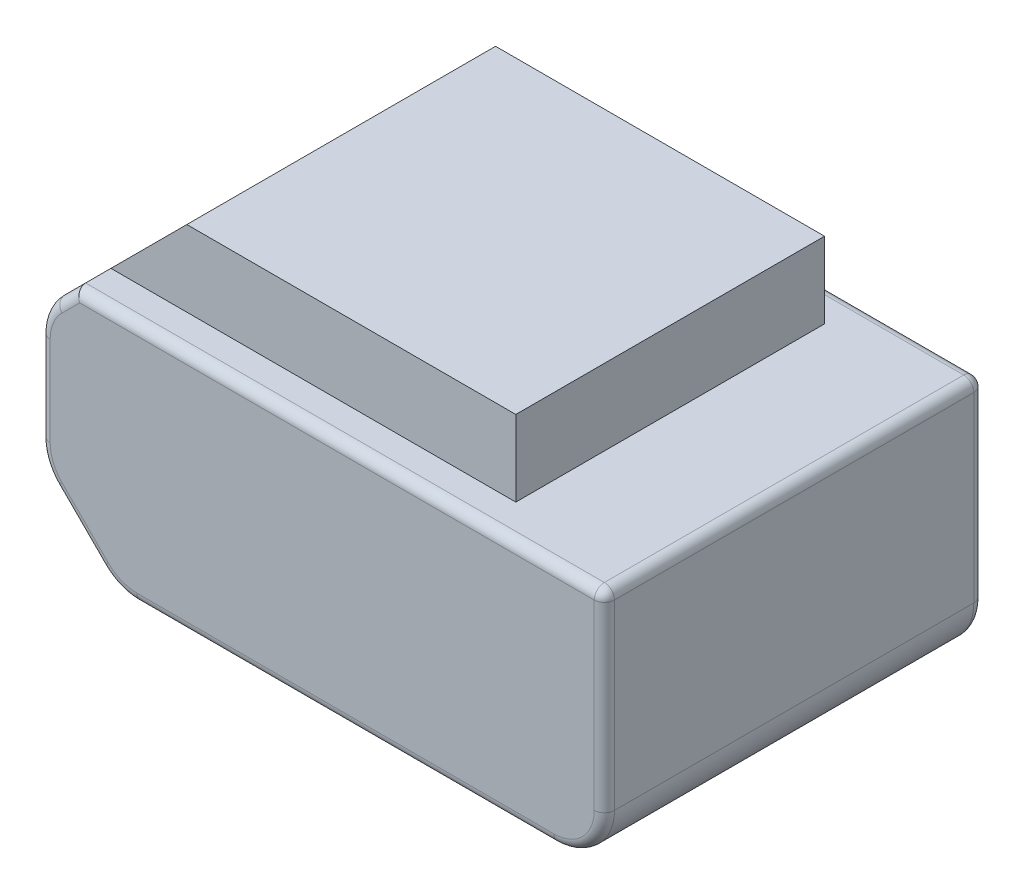
from build123d import *

# Parameters (mm, degrees)
SKETCH1_W           = 111.5
SKETCH1_H           = 75
BOSS_EXTRUDE1_DEPTH = 63
CUT_EXTRUDE1_REACH  = 114.703
SKETCH3_W           = 22
SKETCH3_H           = 7
CUT_EXTRUDE2_DEPTH  = 15
CUT_EXTRUDE3_DEPTH  = 15
FILLET1_R           = 10
FILLET2_R           = 2


with BuildPart() as part:
    # Sketch1 → Boss-Extrude1 (new body)
    with BuildSketch(Plane(origin=(0, 0, 0), x_dir=(1, 0, 0), z_dir=(0, 1, 0))):
        Rectangle(SKETCH1_W, SKETCH1_H)
    extrude(amount=BOSS_EXTRUDE1_DEPTH)

    # Sketch2 → Cut-Extrude1 (cut, up to next)
    with BuildSketch(Plane.XY.offset(37.5), mode=Mode.PRIVATE) as cut_extrude1_sk1:
        Polygon((-55.75, 41), (-33.75, 63), (-55.75, 63), align=None)
    cut_extrude1_tool1 = extrude(cut_extrude1_sk1.sketch, amount=-CUT_EXTRUDE1_REACH, mode=Mode.PRIVATE) & part.part
    # Sketch2 → Cut-Extrude1 (cut, up to next)
    with BuildSketch(Plane.XY.offset(37.5), mode=Mode.PRIVATE) as cut_extrude1_sk2:
        Polygon((-55.75, 15), (-40.75, 0), (-55.75, 0), align=None)
    cut_extrude1_tool2 = extrude(cut_extrude1_sk2.sketch, amount=-CUT_EXTRUDE1_REACH, mode=Mode.PRIVATE) & part.part
    add(cut_extrude1_tool1.solids().sort_by_distance((-48.416667, 55.666667, 37.5))[0], mode=Mode.SUBTRACT)
    add(cut_extrude1_tool2.solids().sort_by_distance((-50.75, 5, 37.5))[0], mode=Mode.SUBTRACT)

    # Sketch3 → Cut-Extrude2 (cut)
    with BuildSketch(Plane(origin=(0, 63, 0), x_dir=(1, 0, 0), z_dir=(0, 1, 0))):
        Polygon((31.25, -30.5), (-33.75, -30.5), (-33.75, -37.5), (55.75, -37.5), (55.75, 37.5), (-33.75, 37.5), (-33.75, 30.5), (31.25, 30.5), align=None)
        with Locations((-44.75, -34)):
            Rectangle(SKETCH3_W, SKETCH3_H)
        with Locations((-44.75, 34)):
            Rectangle(SKETCH3_W, SKETCH3_H)
    extrude(amount=-CUT_EXTRUDE2_DEPTH, mode=Mode.SUBTRACT)

    # Sketch4 → Cut-Extrude3 (cut, symmetric)
    with BuildSketch(Plane.XY):
        Polygon((-53.628679656, 43.121320344), (-38.699747468, 58.050252532), (-38.699747468, 55.221825407), (-50.800252532, 43.121320344), align=None)
    extrude(amount=CUT_EXTRUDE3_DEPTH, both=True, mode=Mode.SUBTRACT)

    # Fillet1
    # the kernel refuses this fillet: 10 mm, written as the material it takes off along each edge
    with BuildSketch(Plane(origin=(-55.75, 41, 47.855339059), x_dir=(0.7071067811865432, 0.7071067811865519, 0), z_dir=(0, 0, -1)), Plane(origin=(-40.75, 0, 47.855339059), x_dir=(-0.707106781186546, 0.707106781186549, 0), z_dir=(0, 0, -1))) as fillet1_piece_1:
        with BuildLine():
            CenterArc((FILLET1_R * 0.414213562373, FILLET1_R), FILLET1_R, 225, 45)
            Line((-FILLET1_R * 0.292893218813, FILLET1_R * 0.292893218813), (0, 0))
            Line((0, 0), (FILLET1_R * 0.414213562373, 0))
        make_face()
    extrude(amount=95.710678119, mode=Mode.SUBTRACT)
    with BuildSketch(Plane(origin=(-55.75, 15, 47.855339059), x_dir=(0.7071067811865466, -0.7071067811865482, 0), z_dir=(0, 0, -1))) as fillet1_piece_2:
        with BuildLine():
            CenterArc((FILLET1_R * 0.414213562373, -FILLET1_R), FILLET1_R, 90, 45)
            Line((-FILLET1_R * 0.292893218813, -FILLET1_R * 0.292893218813), (0, 0))
            Line((0, 0), (FILLET1_R * 0.414213562373, 0))
        make_face()
    extrude(amount=95.710678119, mode=Mode.SUBTRACT)
    with BuildSketch(Plane(origin=(55.75, 0, -62.5), x_dir=(-1, 0, 0), z_dir=(0, 0, 1))) as fillet1_piece_3:
        with BuildLine():
            CenterArc((FILLET1_R, -FILLET1_R), FILLET1_R, 90, 90)
            Line((0, -FILLET1_R), (0, 0))
            Line((0, 0), (FILLET1_R, 0))
        make_face()
    extrude(amount=125, mode=Mode.SUBTRACT)

    # Fillet2
    fillet2_edges = [part.edges().sort_by_distance(p)[0] for p in [
        (4.571067812, 0, -37.5),
        (-48.25, 7.5, -37.5),
        (52.821067812, 2.928932188, -37.5),
        (-40.4346987, 0.761204675, -37.5),
        (-54.988795325, 15.3153013, -37.5),
        (-54.988795325, 40.6846987, -37.5),
        (-50.785533906, 45.964466094, -37.5),
        (55.75, 29, 37.5),
        (55.75, 29, -37.5),
        (3.5, 48, -37.5),
        (3.5, 48, 37.5),
        (55.75, 48, 0),
        (-50.785533906, 45.964466094, 37.5),
        (-55.75, 28, 37.5),
        (-48.25, 7.5, 37.5),
        (4.571067812, 0, 37.5),
        (52.821067812, 2.928932188, 37.5),
        (-40.4346987, 0.761204675, 37.5),
        (-54.988795325, 15.3153013, 37.5),
        (-54.988795325, 40.6846987, 37.5),
        (-55.75, 28, -37.5),
    ]]
    fillet(fillet2_edges, radius=FILLET2_R)


solid = part.part
